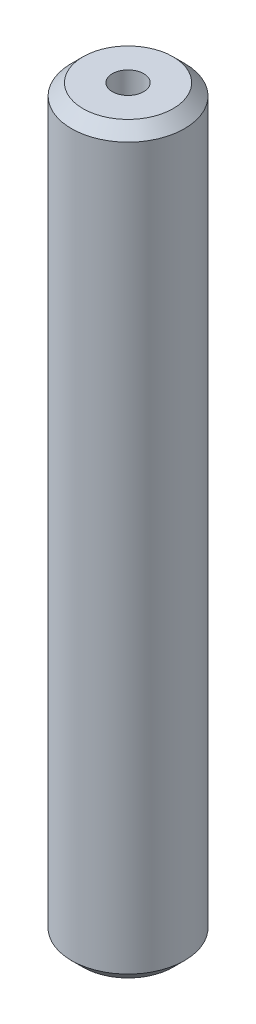
from build123d import *

# Parameters (mm, degrees)
SKETCH1_R           = 12.5
BOSS_EXTRUDE1_DEPTH = 164.353961572
SKETCH2_R           = 3.462703291
CUT_EXTRUDE1_DEPTH  = 166.301919784
CHAMFER1_SIZE       = 2.551592614


with BuildPart() as part:
    # Sketch1 → Boss-Extrude1 (new body)
    with BuildSketch(Plane(origin=(0, 0, 0), x_dir=(1, 0, 0), z_dir=(0, 1, 0))):
        Circle(SKETCH1_R)
    extrude(amount=BOSS_EXTRUDE1_DEPTH)

    # Sketch2 → Cut-Extrude1 (cut, through all)
    with BuildSketch(Plane(origin=(0, 0, 0), x_dir=(1, 0, 0), z_dir=(0, 1, 0))):
        Circle(SKETCH2_R)
    extrude(amount=CUT_EXTRUDE1_DEPTH, mode=Mode.SUBTRACT)

    # Chamfer1
    chamfer1_edges = [part.edges().sort_by_distance(p)[0] for p in [
        (-12.5, 164.353961572, 0),
        (-12.5, 0, 0),
    ]]
    chamfer(chamfer1_edges, length=CHAMFER1_SIZE)


solid = part.part
